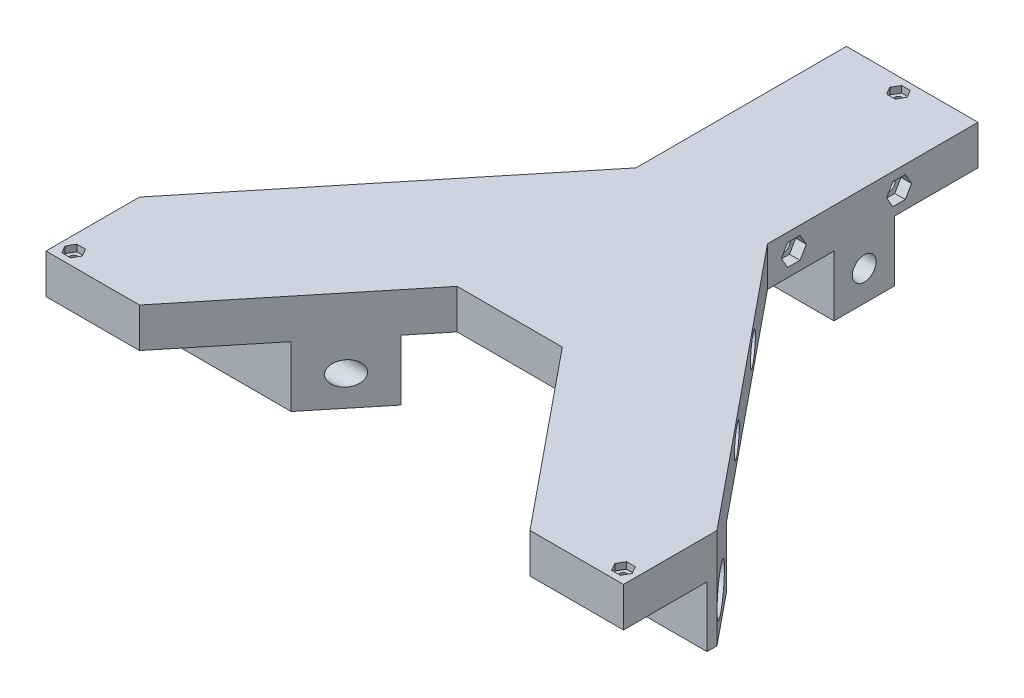
from build123d import *

# Parameters (mm, degrees)
BOSS_EXTRUDE1_DEPTH      = 15
SKETCH4_R                = 2.55
CUT_EXTRUDE1_DEPTH       = 311.78207799
CUT_EXTRUDE3_DEPTH       = 258.997698633
CUT_EXTRUDE3_DEPTH_BACK  = 3.5
SKETCH5_R                = 4.25
SKETCH6_R                = 5
CUT_EXTRUDE4_DEPTH       = 258.997698633
CUT_EXTRUDE5_DEPTH       = 4
SKETCH8_R                = 1.6
CUT_EXTRUDE6_DEPTH       = 246.866452571
CUT_EXTRUDE7_DEPTH       = 2.5
SKETCH10_W               = 50
SKETCH10_H               = 23
BOSS_EXTRUDE2_DEPTH      = 23
CUT_EXTRUDE8_START       = -24
SKETCH11_R               = 7.6
CUT_EXTRUDE8_DEPTH       = 325.431928593
SKETCH12_R               = 4.5
CUT_EXTRUDE9_DEPTH       = 301.431928593
SKETCH13_R               = 4.5
CUT_EXTRUDE10_DEPTH      = 259.586180025
CUT_EXTRUDE11_DEPTH      = 12.5
CUT_EXTRUDE11_DEPTH_BACK = 12.5
SKETCH14_R               = 7.6


with BuildPart() as part:
    # Sketch1 → Boss-Extrude1 (new body)
    with BuildSketch(Plane(origin=(0, 0, 0), x_dir=(1, 0, 0), z_dir=(0, 1, 0))):
        Polygon((25, 0), (-25, 0), (-25, -80), (-109.75, -183.961915416), (-109.75, -219.5), (-74.211915416, -219.5), (-20, -152.998825191), (20, -152.998825191), (74.211915416, -219.5), (109.75, -219.5), (109.75, -183.961915416), (25, -80), align=None)
    extrude(amount=BOSS_EXTRUDE1_DEPTH)

    # Sketch4 → Cut-Extrude1 (cut, through all)
    with BuildSketch(Plane.ZY.offset(109.75)):
        with Locations((30, 7.5)):
            Circle(SKETCH4_R)
        with Locations((70, 7.5)):
            Circle(SKETCH4_R)
        with Locations((110, 7.5)):
            Circle(SKETCH4_R)
        with Locations((142.998825191, 7.5)):
            Circle(SKETCH4_R)
    extrude(amount=-CUT_EXTRUDE1_DEPTH, mode=Mode.SUBTRACT)

    # Sketch5 → Cut-Extrude3 (cut, two sides: drawn at the far end of the back side and taken through both)
    with BuildSketch(Plane.ZY.offset(25).offset(-CUT_EXTRUDE3_DEPTH_BACK)):
        with Locations((30, 7.5)):
            Circle(SKETCH5_R)
        with Locations((70, 7.5)):
            Circle(SKETCH5_R)
        with Locations((110, 7.5)):
            Circle(SKETCH5_R)
        with Locations((142.998825191, 7.5)):
            Circle(SKETCH5_R)
    extrude(amount=CUT_EXTRUDE3_DEPTH + CUT_EXTRUDE3_DEPTH_BACK, mode=Mode.SUBTRACT)

    # Sketch6 → Cut-Extrude4 (cut, through all)
    with BuildSketch(Plane(origin=(25, 0, 0), x_dir=(0, 0, -1), z_dir=(1, 0, 0))):
        with Locations((-142.998825191, 7.5)):
            Circle(SKETCH6_R)
        with Locations((-110, 7.5)):
            Circle(SKETCH6_R)
    extrude(amount=CUT_EXTRUDE4_DEPTH, mode=Mode.SUBTRACT)

    # Sketch7 → Cut-Extrude5 (cut)
    with BuildSketch(Plane(origin=(25, 0, 0), x_dir=(0, 0, -1), z_dir=(1, 0, 0))):
        Polygon((-34.734272207, 7.5), (-32.367136104, 3.4), (-27.632863896, 3.4), (-25.265727793, 7.5), (-27.632863896, 11.6), (-32.367136104, 11.6), align=None)
        Polygon((-74.734272207, 7.5), (-72.367136104, 3.4), (-67.632863896, 3.4), (-65.265727793, 7.5), (-67.632863896, 11.6), (-72.367136104, 11.6), align=None)
        Polygon((-114.734272207, 7.5), (-112.367136104, 3.4), (-107.632863896, 3.4), (-105.265727793, 7.5), (-107.632863896, 11.6), (-112.367136104, 11.6), align=None)
        Polygon((-147.733097398, 7.5), (-145.365961294, 3.4), (-140.631689087, 3.4), (-138.264552983, 7.5), (-140.631689087, 11.6), (-145.365961294, 11.6), align=None)
    extrude(amount=-CUT_EXTRUDE5_DEPTH, mode=Mode.SUBTRACT)

    # Sketch8 → Cut-Extrude6 (cut, through all)
    with BuildSketch(Plane(origin=(0, 15, 0), x_dir=(1, 0, 0), z_dir=(0, 1, 0))):
        with Locations((0, -5.25)):
            Circle(SKETCH8_R)
        with Locations((-104.5, -214.25)):
            Circle(SKETCH8_R)
        with Locations((104.5, -214.25)):
            Circle(SKETCH8_R)
    extrude(amount=-CUT_EXTRUDE6_DEPTH, mode=Mode.SUBTRACT)

    # Sketch9 → Cut-Extrude7 (cut)
    with BuildSketch(Plane(origin=(0, 15, 0), x_dir=(1, 0, 0), z_dir=(0, 1, 0))):
        Polygon((-101.209103466, -214.25), (-102.854551733, -211.4), (-106.145448267, -211.4), (-107.790896534, -214.25), (-106.145448267, -217.1), (-102.854551733, -217.1), align=None)
        Polygon((101.209103466, -214.25), (102.854551733, -217.1), (106.145448267, -217.1), (107.790896534, -214.25), (106.145448267, -211.4), (102.854551733, -211.4), align=None)
        Polygon((3.290896534, -5.25), (1.645448267, -2.4), (-1.645448267, -2.4), (-3.290896534, -5.25), (-1.645448267, -8.1), (1.645448267, -8.1), align=None)
    extrude(amount=-CUT_EXTRUDE7_DEPTH, mode=Mode.SUBTRACT)

    # Sketch10 → Boss-Extrude2 (add)
    with BuildSketch(Plane.XZ):
        with Locations((0, 43.25)):
            Rectangle(SKETCH10_W, SKETCH10_H)
        Polygon((94.08840099, 164.75), (29.579585573, 164.75), (48.329240119, 187.75), (109.75, 187.75), (109.75, 183.961915416), align=None)
        Polygon((-109.75, 187.75), (-109.75, 183.961915416), (-94.08840099, 164.75), (-29.579585573, 164.75), (-48.329240119, 187.75), align=None)
    extrude(amount=BOSS_EXTRUDE2_DEPTH)

    # Sketch11 → Cut-Extrude8 (cut)
    with BuildSketch(Plane.ZY.offset(94.08840099).offset(CUT_EXTRUDE8_START)):
        with Locations((176.25, -11.5)):
            Circle(SKETCH11_R)
    cut_extrude8 = extrude(amount=CUT_EXTRUDE8_DEPTH, mode=Mode.SUBTRACT)

    # Sketch12 → Cut-Extrude9 (cut, through all)
    with BuildSketch(Plane.ZY.offset(94.08840099)):
        with Locations((176.25, -11.5)):
            Circle(SKETCH12_R)
    extrude(amount=-CUT_EXTRUDE9_DEPTH, mode=Mode.SUBTRACT)

    # Mirror1: Cut-Extrude8 across plane
    add(cut_extrude8.mirror(Plane(origin=(0, 0, 0), x_dir=(0, 0, 1), z_dir=(1, 0, 0))), mode=Mode.SUBTRACT)

    # Sketch13 → Cut-Extrude10 (cut, through all)
    with BuildSketch(Plane.ZY.offset(25)):
        with Locations((43.25, -11.5)):
            Circle(SKETCH13_R)
    extrude(amount=-CUT_EXTRUDE10_DEPTH, mode=Mode.SUBTRACT)

    # Sketch14 → Cut-Extrude11 (cut, two sides: drawn at the far end of the back side and taken through both)
    with BuildSketch(Plane(origin=(0, 0, 0), x_dir=(0, 0, -1), z_dir=(1, 0, 0)).offset(-CUT_EXTRUDE11_DEPTH_BACK)):
        with Locations((-43.25, -11.5)):
            Circle(SKETCH14_R)
    extrude(amount=CUT_EXTRUDE11_DEPTH + CUT_EXTRUDE11_DEPTH_BACK, mode=Mode.SUBTRACT)


solid = part.part
